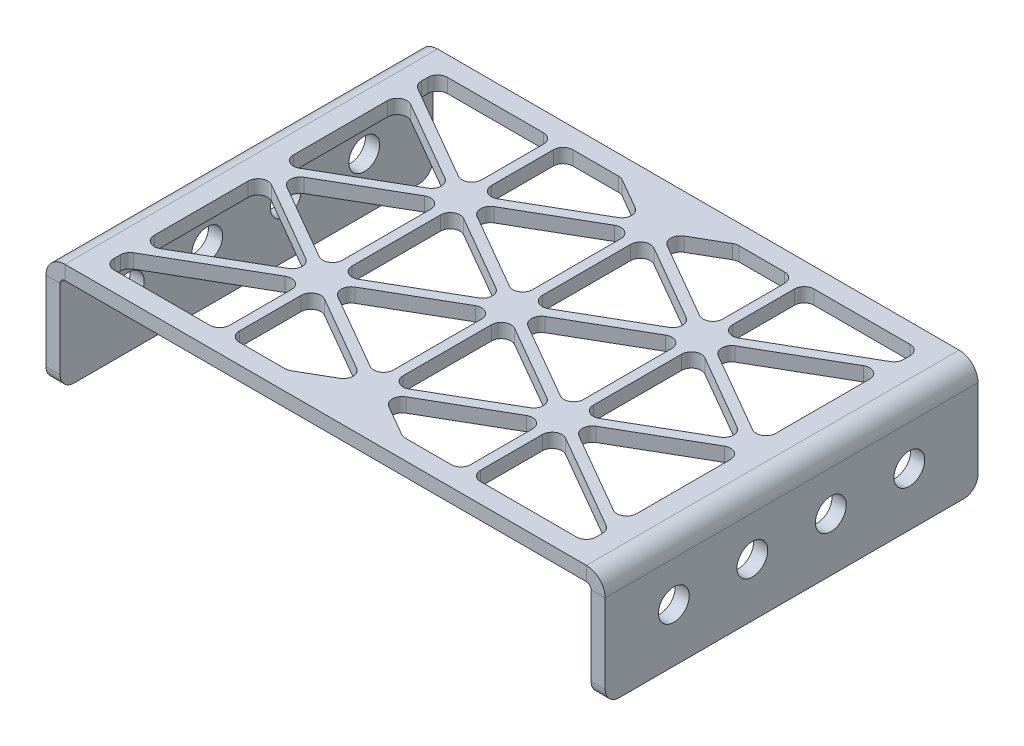
from build123d import *

# Parameters (mm, degrees)
BASE_FLANGE1_DEPTH      = 60.325
CUT_EXTRUDE1_DEPTH      = 77.096139792
CUT_EXTRUDE1_DEPTH_BACK = 77.096139792
SKETCH6_R               = 2.4892
CUT_EXTRUDE2_DEPTH      = 78.562390758
FILLET2_R               = 1.5875
FILLET3_R               = 2.286


# Sheet-metal steps are written as plain solids
with BuildPart() as part:
    # Sketch1 → Base-Flange1 (new body)
    with BuildSketch(Plane.XY):
        with BuildLine():
            Line((-42.95775, -7.9375), (-42.95775, 7.1755))
            ThreePointArc((-42.95775, 7.1755), (-42.734565367, 7.714315367), (-42.19575, 7.9375))
            Line((-42.19575, 7.9375), (42.19575, 7.9375))
            ThreePointArc((42.19575, 7.9375), (42.734565367, 7.714315367), (42.95775, 7.1755))
            Line((42.95775, 7.1755), (42.95775, -7.9375))
            Line((42.95775, -7.9375), (45.24375, -7.9375))
            Line((45.24375, -7.9375), (45.24375, 7.1755))
            ThreePointArc((45.24375, 7.1755), (44.351011469, 9.330761469), (42.19575, 10.2235))
            Line((42.19575, 10.2235), (-42.19575, 10.2235))
            ThreePointArc((-42.19575, 10.2235), (-44.351011469, 9.330761469), (-45.24375, 7.1755))
            Line((-45.24375, 7.1755), (-45.24375, -7.9375))
            Line((-45.24375, -7.9375), (-42.95775, -7.9375))
        make_face()
    extrude(amount=BASE_FLANGE1_DEPTH)

    # Sketch6 → Cut-Extrude1 (cut, two sides: drawn at the far end of the back side and taken through both)
    with BuildSketch(Plane(origin=(0, 0, 0), x_dir=(0, 0, -1), z_dir=(1, 0, 0)).offset(-CUT_EXTRUDE1_DEPTH_BACK)):
        with Locations((-11.1125, 0.698540894)):
            Circle(SKETCH6_R)
        with Locations((-23.8125, 0.698540894)):
            Circle(SKETCH6_R)
        with Locations((-36.5125, 0.698540894)):
            Circle(SKETCH6_R)
        with Locations((-49.2125, 0.698540894)):
            Circle(SKETCH6_R)
    extrude(amount=CUT_EXTRUDE1_DEPTH + CUT_EXTRUDE1_DEPTH_BACK, mode=Mode.SUBTRACT)

    # Sketch7 → Cut-Extrude2 (cut, through all)
    with BuildSketch(Plane(origin=(0, 10.2235, 0), x_dir=(1, 0, 0), z_dir=(0, 1, 0))):
        Polygon((-20.304125, -17.523364413), (-20.304125, -3.175), (-39.02075, -3.175), (-39.02075, -6.717315931), align=None)
        Polygon((-7.01675, -4.499280535), (-9.310471169, -3.175), (-18.716625, -3.175), (-18.716625, -17.523364413), (-1.5875, -7.633859484), align=None)
        Polygon((-0.79375, -28.787684671), (-0.79375, -9.008674812), (-17.922875, -18.898179742), align=None)
        Polygon((18.716625, -17.523364413), (18.716625, -3.175), (9.310471169, -3.175), (7.01675, -4.499280535), (1.5875, -7.633859484), align=None)
        Polygon((0.79375, -28.787684671), (17.922875, -18.898179742), (0.79375, -9.008674812), align=None)
        Polygon((39.02075, -6.717315931), (39.02075, -3.175), (20.304125, -3.175), (20.304125, -17.523364413), align=None)
        Polygon((39.02075, -29.245956448), (39.02075, -8.550403036), (21.097875, -18.898179742), align=None)
        Polygon((20.304125, -40.05200493), (37.43325, -30.1625), (20.304125, -20.27299507), align=None)
        Polygon((18.716625, -40.05200493), (18.716625, -20.27299507), (1.5875, -30.1625), align=None)
        Polygon((0.79375, -51.316325188), (17.922875, -41.426820258), (0.79375, -31.537315329), align=None)
        Polygon((18.716625, -57.15), (18.716625, -42.801635587), (1.5875, -52.691140516), (7.01675, -55.825719465), (9.310471169, -57.15), align=None)
        Polygon((39.02075, -57.15), (39.02075, -53.607684069), (20.304125, -42.801635587), (20.304125, -57.15), align=None)
        Polygon((39.02075, -51.774596964), (39.02075, -31.079043552), (21.097875, -41.426820258), align=None)
        Polygon((-7.01675, -55.825719465), (-1.5875, -52.691140516), (-18.716625, -42.801635587), (-18.716625, -57.15), (-9.310471169, -57.15), align=None)
        Polygon((-0.79375, -51.316325188), (-0.79375, -31.537315329), (-17.922875, -41.426820258), align=None)
        Polygon((-18.716625, -40.05200493), (-1.5875, -30.1625), (-18.716625, -20.27299507), align=None)
        Polygon((-20.304125, -40.05200493), (-20.304125, -20.27299507), (-37.43325, -30.1625), align=None)
        Polygon((-39.02075, -29.245956448), (-21.097875, -18.898179742), (-39.02075, -8.550403036), align=None)
        Polygon((-39.02075, -51.774596964), (-21.097875, -41.426820258), (-39.02075, -31.079043552), align=None)
        Polygon((-20.304125, -57.15), (-20.304125, -42.801635587), (-39.02075, -53.607684069), (-39.02075, -57.15), align=None)
    extrude(amount=-CUT_EXTRUDE2_DEPTH, mode=Mode.SUBTRACT)

    # Fillet2
    fillet2_edges = [part.edges().sort_by_distance(p)[0] for p in [
        (-17.922875, 9.0805, 41.426820258),
        (-0.79375, 9.0805, 31.537315329),
        (-0.79375, 9.0805, 51.316325188),
        (-1.5875, 9.0805, 52.691140516),
        (-9.310471169, 9.0805, 57.15),
        (-18.716625, 9.0805, 57.15),
        (-18.716625, 9.0805, 42.801635587),
        (-18.716625, 9.0805, 20.27299507),
        (-1.5875, 9.0805, 30.1625),
        (-18.716625, 9.0805, 40.05200493),
        (-37.43325, 9.0805, 30.1625),
        (-20.304125, 9.0805, 20.27299507),
        (-20.304125, 9.0805, 40.05200493),
        (20.304125, 9.0805, 42.801635587),
        (39.02075, 9.0805, 53.607684069),
        (39.02075, 9.0805, 57.15),
        (20.304125, 9.0805, 57.15),
        (21.097875, 9.0805, 41.426820258),
        (39.02075, 9.0805, 31.079043552),
        (39.02075, 9.0805, 51.774596964),
        (0.79375, 9.0805, 31.537315329),
        (17.922875, 9.0805, 41.426820258),
        (0.79375, 9.0805, 51.316325188),
        (9.310471169, 9.0805, 57.15),
        (1.5875, 9.0805, 52.691140516),
        (18.716625, 9.0805, 42.801635587),
        (18.716625, 9.0805, 57.15),
        (-17.922875, 9.0805, 18.898179742),
        (-0.79375, 9.0805, 9.008674812),
        (-0.79375, 9.0805, 28.787684671),
        (-9.310471169, 9.0805, 3.175),
        (-1.5875, 9.0805, 7.633859484),
        (-18.716625, 9.0805, 17.523364413),
        (-18.716625, 9.0805, 3.175),
        (0.79375, 9.0805, 9.008674812),
        (17.922875, 9.0805, 18.898179742),
        (0.79375, 9.0805, 28.787684671),
        (1.5875, 9.0805, 7.633859484),
        (9.310471169, 9.0805, 3.175),
        (18.716625, 9.0805, 3.175),
        (18.716625, 9.0805, 17.523364413),
        (1.5875, 9.0805, 30.1625),
        (18.716625, 9.0805, 20.27299507),
        (18.716625, 9.0805, 40.05200493),
        (20.304125, 9.0805, 40.05200493),
        (20.304125, 9.0805, 20.27299507),
        (37.43325, 9.0805, 30.1625),
        (20.304125, 9.0805, 3.175),
        (39.02075, 9.0805, 3.175),
        (39.02075, 9.0805, 6.717315931),
        (20.304125, 9.0805, 17.523364413),
        (21.097875, 9.0805, 18.898179742),
        (39.02075, 9.0805, 8.550403036),
        (39.02075, 9.0805, 29.245956448),
        (-20.304125, 9.0805, 42.801635587),
        (-20.304125, 9.0805, 57.15),
        (-39.02075, 9.0805, 57.15),
        (-39.02075, 9.0805, 53.607684069),
        (-39.02075, 9.0805, 51.774596964),
        (-39.02075, 9.0805, 31.079043552),
        (-21.097875, 9.0805, 41.426820258),
        (-39.02075, 9.0805, 29.245956448),
        (-39.02075, 9.0805, 8.550403036),
        (-21.097875, 9.0805, 18.898179742),
        (-39.02075, 9.0805, 6.717315931),
        (-39.02075, 9.0805, 3.175),
        (-20.304125, 9.0805, 3.175),
        (-20.304125, 9.0805, 17.523364413),
    ]]
    fillet(fillet2_edges, radius=FILLET2_R)

    # Fillet3
    fillet3_edges = [part.edges().sort_by_distance(p)[0] for p in [
        (44.10075, -7.9375, 0),
        (-44.10075, -7.9375, 0),
        (44.10075, -7.9375, 60.325),
        (-44.10075, -7.9375, 60.325),
    ]]
    fillet(fillet3_edges, radius=FILLET3_R)


solid = part.part
